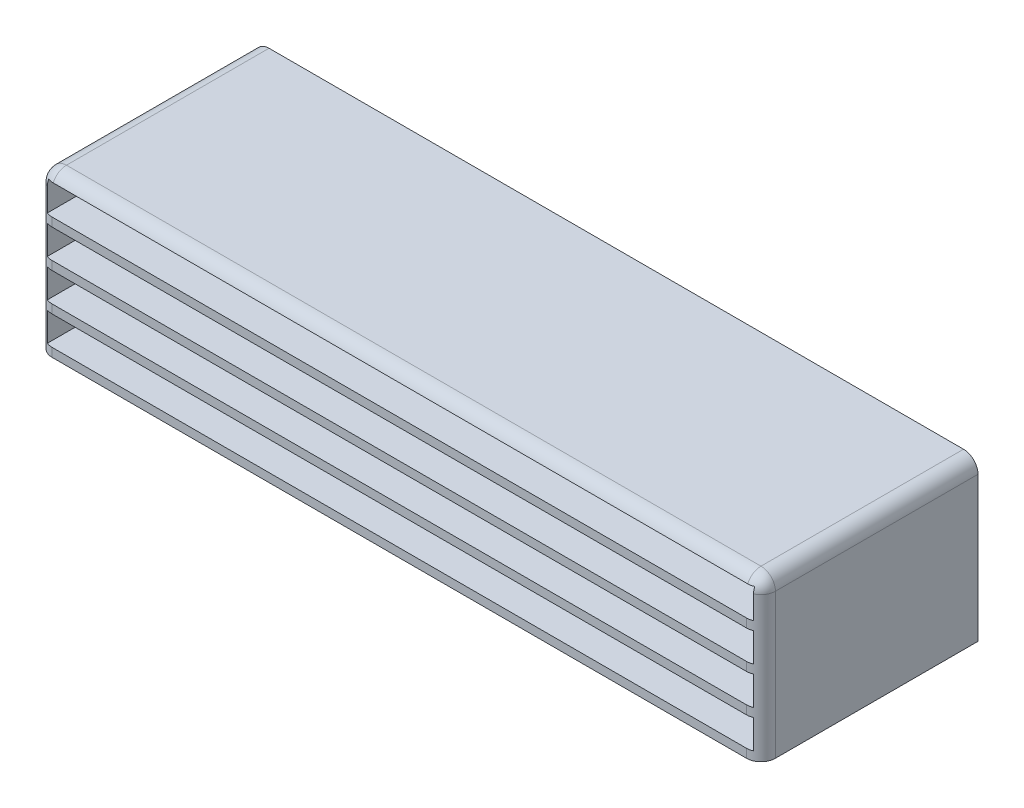
from build123d import *

# Parameters (mm, degrees)
SKETCH1_W           = 3
SKETCH1_H           = 3
SKETCH1_H_2         = 10
SKETCH1_W_2         = 244
BOSS_EXTRUDE1_DEPTH = 3
SKETCH1_4_W         = 3
SKETCH1_4_H         = 3
SKETCH1_4_H_2       = 10
SKETCH1_4_W_2       = 244
BOSS_EXTRUDE2_DEPTH = 75
FILLET1_R           = 5
FILLET2_R           = 5


with BuildPart() as part:
    # Sketch1 → Boss-Extrude1 (new body)
    with BuildSketch(Plane.XY):
        with Locations((-80.354290742, 77.454120293)):
            Rectangle(SKETCH1_W, SKETCH1_H)
        with Locations((-80.354290742, 70.954120293)):
            Rectangle(SKETCH1_W, SKETCH1_H_2)
        with Locations((-80.354290742, 64.454120293)):
            Rectangle(SKETCH1_W, SKETCH1_H)
        with Locations((-80.354290742, 57.954120293)):
            Rectangle(SKETCH1_W, SKETCH1_H_2)
        with Locations((-80.354290742, 51.454120293)):
            Rectangle(SKETCH1_W, SKETCH1_H)
        with Locations((-80.354290742, 44.954120293)):
            Rectangle(SKETCH1_W, SKETCH1_H_2)
        with Locations((-80.354290742, 38.454120293)):
            Rectangle(SKETCH1_W, SKETCH1_H)
        with Locations((-80.354290742, 31.954120293)):
            Rectangle(SKETCH1_W, SKETCH1_H_2)
        with Locations((-80.354290742, 25.454120293)):
            Rectangle(SKETCH1_W, SKETCH1_H)
        with Locations((43.145709258, 25.454120293)):
            Rectangle(SKETCH1_W_2, SKETCH1_H)
        with Locations((43.145709258, 31.954120293)):
            Rectangle(SKETCH1_W_2, SKETCH1_H_2)
        with Locations((43.145709258, 38.454120293)):
            Rectangle(SKETCH1_W_2, SKETCH1_H)
        with Locations((43.145709258, 44.954120293)):
            Rectangle(SKETCH1_W_2, SKETCH1_H_2)
        with Locations((43.145709258, 51.454120293)):
            Rectangle(SKETCH1_W_2, SKETCH1_H)
        with Locations((43.145709258, 57.954120293)):
            Rectangle(SKETCH1_W_2, SKETCH1_H_2)
        with Locations((43.145709258, 64.454120293)):
            Rectangle(SKETCH1_W_2, SKETCH1_H)
        with Locations((43.145709258, 70.954120293)):
            Rectangle(SKETCH1_W_2, SKETCH1_H_2)
        with Locations((43.145709258, 77.454120293)):
            Rectangle(SKETCH1_W_2, SKETCH1_H)
        with Locations((166.645709258, 77.454120293)):
            Rectangle(SKETCH1_W, SKETCH1_H)
        with Locations((166.645709258, 70.954120293)):
            Rectangle(SKETCH1_W, SKETCH1_H_2)
        with Locations((166.645709258, 64.454120293)):
            Rectangle(SKETCH1_W, SKETCH1_H)
        with Locations((166.645709258, 57.954120293)):
            Rectangle(SKETCH1_W, SKETCH1_H_2)
        with Locations((166.645709258, 51.454120293)):
            Rectangle(SKETCH1_W, SKETCH1_H)
        with Locations((166.645709258, 44.954120293)):
            Rectangle(SKETCH1_W, SKETCH1_H_2)
        with Locations((166.645709258, 38.454120293)):
            Rectangle(SKETCH1_W, SKETCH1_H)
        with Locations((166.645709258, 31.954120293)):
            Rectangle(SKETCH1_W, SKETCH1_H_2)
        with Locations((166.645709258, 25.454120293)):
            Rectangle(SKETCH1_W, SKETCH1_H)
    extrude(amount=BOSS_EXTRUDE1_DEPTH)

    # Sketch1<4> → Boss-Extrude2 (add)
    with BuildSketch(Plane.XY):
        with Locations((-80.354290742, 77.454120293)):
            Rectangle(SKETCH1_4_W, SKETCH1_4_H)
        with Locations((-80.354290742, 70.954120293)):
            Rectangle(SKETCH1_4_W, SKETCH1_4_H_2)
        with Locations((-80.354290742, 64.454120293)):
            Rectangle(SKETCH1_4_W, SKETCH1_4_H)
        with Locations((-80.354290742, 57.954120293)):
            Rectangle(SKETCH1_4_W, SKETCH1_4_H_2)
        with Locations((-80.354290742, 51.454120293)):
            Rectangle(SKETCH1_4_W, SKETCH1_4_H)
        with Locations((-80.354290742, 44.954120293)):
            Rectangle(SKETCH1_4_W, SKETCH1_4_H_2)
        with Locations((43.145709258, 51.454120293)):
            Rectangle(SKETCH1_4_W_2, SKETCH1_4_H)
        with Locations((43.145709258, 64.454120293)):
            Rectangle(SKETCH1_4_W_2, SKETCH1_4_H)
        with Locations((43.145709258, 77.454120293)):
            Rectangle(SKETCH1_4_W_2, SKETCH1_4_H)
        with Locations((-80.354290742, 38.454120293)):
            Rectangle(SKETCH1_4_W, SKETCH1_4_H)
        with Locations((-80.354290742, 31.954120293)):
            Rectangle(SKETCH1_4_W, SKETCH1_4_H_2)
        with Locations((-80.354290742, 25.454120293)):
            Rectangle(SKETCH1_4_W, SKETCH1_4_H)
        with Locations((43.145709258, 25.454120293)):
            Rectangle(SKETCH1_4_W_2, SKETCH1_4_H)
        with Locations((43.145709258, 38.454120293)):
            Rectangle(SKETCH1_4_W_2, SKETCH1_4_H)
        with Locations((166.645709258, 77.454120293)):
            Rectangle(SKETCH1_4_W, SKETCH1_4_H)
        with Locations((166.645709258, 70.954120293)):
            Rectangle(SKETCH1_4_W, SKETCH1_4_H_2)
        with Locations((166.645709258, 64.454120293)):
            Rectangle(SKETCH1_4_W, SKETCH1_4_H)
        with Locations((166.645709258, 57.954120293)):
            Rectangle(SKETCH1_4_W, SKETCH1_4_H_2)
        with Locations((166.645709258, 51.454120293)):
            Rectangle(SKETCH1_4_W, SKETCH1_4_H)
        with Locations((166.645709258, 44.954120293)):
            Rectangle(SKETCH1_4_W, SKETCH1_4_H_2)
        with Locations((166.645709258, 38.454120293)):
            Rectangle(SKETCH1_4_W, SKETCH1_4_H)
        with Locations((166.645709258, 31.954120293)):
            Rectangle(SKETCH1_4_W, SKETCH1_4_H_2)
        with Locations((166.645709258, 25.454120293)):
            Rectangle(SKETCH1_4_W, SKETCH1_4_H)
    extrude(amount=BOSS_EXTRUDE2_DEPTH)

    # Fillet1
    fillet1_edges = [part.edges().sort_by_distance(p)[0] for p in [
        (-81.854290742, 78.954120293, 37.5),
        (168.145709258, 78.954120293, 37.5),
    ]]
    fillet(fillet1_edges, radius=FILLET1_R)

    # Fillet2
    # the kernel refuses this fillet: 5 mm, written as the material it takes off along each edge
    with BuildSketch(Plane(origin=(168.145709258, 73.954120293, 75), x_dir=(-1, 0, 0), z_dir=(0, -1, 0)), Plane(origin=(-81.854290742, 11.454120293, 75), x_dir=(1, 0, 0), z_dir=(0, 1, 0))) as fillet2_piece_1:
        with BuildLine():
            CenterArc((FILLET2_R, FILLET2_R), FILLET2_R, 180, 90)
            Line((0, FILLET2_R), (0, 0))
            Line((0, 0), (FILLET2_R, 0))
        make_face()
    extrude(amount=62.5, mode=Mode.SUBTRACT)
    with BuildSketch(Plane(origin=(-76.854290742, 73.954120293, 75), x_dir=(0, 1, 0), z_dir=(1, 0, 0))) as fillet2_piece_2:
        with BuildLine():
            CenterArc((5 - FILLET2_R, -FILLET2_R), FILLET2_R, 0, 90)
            Line((5 - FILLET2_R, 0), (5, 0))
            Line((5, 0), (5, -FILLET2_R))
        make_face()
    revolve(axis=Axis((-76.854290742, 73.954120293, 75), (0, 0, 1)), revolution_arc=90, mode=Mode.SUBTRACT)
    with BuildSketch(Plane(origin=(-76.854290742, 78.954120293, 75), x_dir=(0, 0, -1), z_dir=(1, 0, 0))) as fillet2_piece_3:
        with BuildLine():
            CenterArc((FILLET2_R, -FILLET2_R), FILLET2_R, 90, 90)
            Line((0, -FILLET2_R), (0, 0))
            Line((0, 0), (FILLET2_R, 0))
        make_face()
    extrude(amount=240, mode=Mode.SUBTRACT)
    with BuildSketch(Plane(origin=(163.145709258, 73.954120293, 75), x_dir=(0, 1, 0), z_dir=(-1, 0, 0))) as fillet2_piece_4:
        with BuildLine():
            CenterArc((5 - FILLET2_R, FILLET2_R), FILLET2_R, 270, 90)
            Line((5 - FILLET2_R, 0), (5, 0))
            Line((5, 0), (5, FILLET2_R))
        make_face()
    revolve(axis=Axis((163.145709258, 73.954120293, 75), (0, 0, -1)), revolution_arc=90, mode=Mode.SUBTRACT)


solid = part.part
